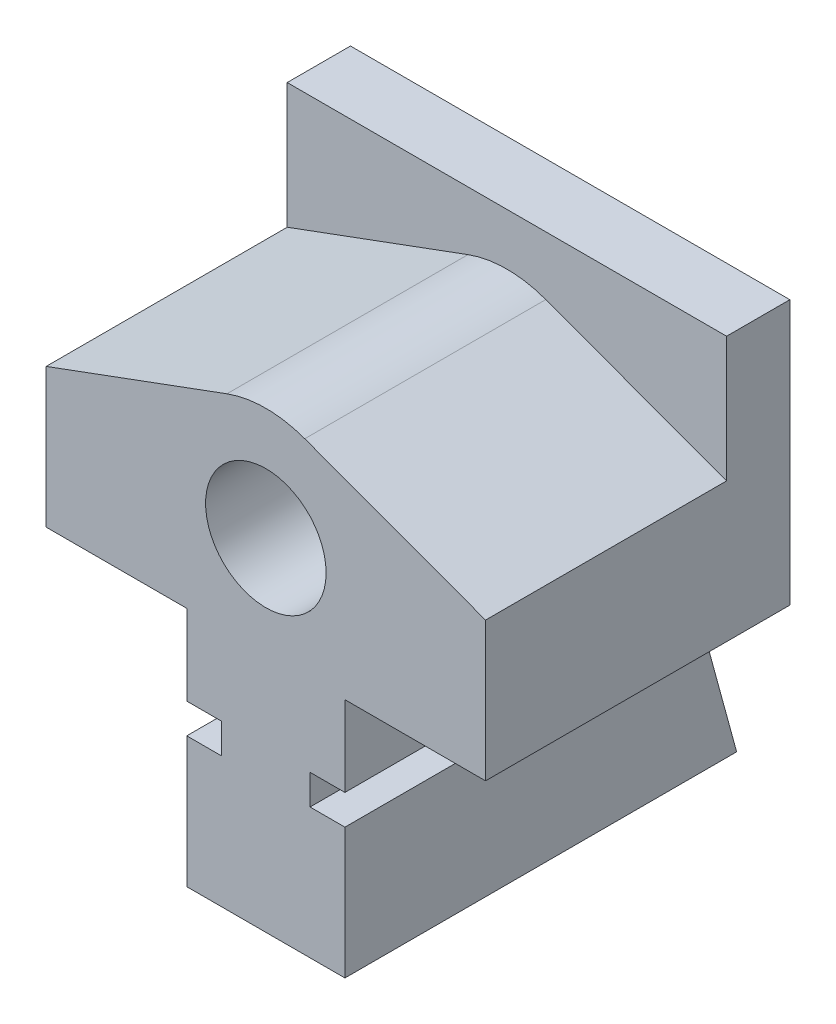
from build123d import *

# Parameters (mm, degrees)
EXTRUDE1_DEPTH                   = 38.1
EXTRUDE2_DEPTH                   = 38.1
SKETCH4_W                        = 69.45
SKETCH4_H                        = 41.814012965
EXTRUDE3_DEPTH                   = 10
EXTRUDE4_DEPTH                   = 23.8125
CUT_EXTRUDE4_DEPTH               = 107.888880382
CUT_EXTRUDE4_DEPTH_BACK          = 107.888880382
F_25_0_1495_DIAMETER_HOLE1_D     = 3.7973
F_25_0_1495_DIAMETER_HOLE1_DEPTH = 26.9875
F_25_0_1495_DIAMETER_HOLE1_TIP   = 1.140824014
SKETCH11_R                       = 9.525
CUT_EXTRUDE2_DEPTH               = 30.1625
SKETCH12_R                       = 10.31875
CUT_EXTRUDE3_DEPTH               = 93.736926805
CUT_EXTRUDE5_START               = -12.5
CUT_EXTRUDE5_DEPTH               = 25


# Read off the part's stored shape, not the designer's step: Cut-Extrude5
with BuildPart() as part:
    # Sketch1 → Extrude1 (new body)
    with BuildSketch(Plane.XY):
        Polygon((12.5, 0), (-12.5, 0), (-12.5, 20.6502), (-6.9882, 20.6502), (-6.9882, 25.4), (-12.5, 25.4), (-12.5, 38.1), (-34.725, 38.1), (-34.725, 49.506590038), (34.725, 49.506590038), (34.725, 38.1), (12.5, 38.1), (12.5, 25.4), (6.9882, 25.4), (6.9882, 20.6502), (12.5, 20.6502), align=None)
    extrude(amount=-EXTRUDE1_DEPTH)

    # Sketch2 → Extrude2 (add)
    with BuildSketch(Plane.XY):
        with BuildLine():
            Line((-34.725, 60.107063342), (-34.725, 49.506590038))
            Line((-34.725, 49.506590038), (34.725, 49.506590038))
            Line((34.725, 49.506590038), (34.725, 60.107063342))
            Line((34.725, 60.107063342), (6.151391783, 70.643423952))
            ThreePointArc((6.151391783, 70.643423952), (0, 71.741434289), (-6.151391783, 70.643423952))
            Line((-6.151391783, 70.643423952), (-34.725, 60.107063342))
        make_face()
    extrude(amount=-EXTRUDE2_DEPTH)

    # Sketch4 → Extrude3 (add)
    with BuildSketch(Plane(origin=(0, 0, -38.1), x_dir=(-1, 0, 0), z_dir=(0, 0, -1))):
        with Locations((0, 59.007006483)):
            Rectangle(SKETCH4_W, SKETCH4_H)
    extrude(amount=EXTRUDE3_DEPTH)

    # Sketch13 → Extrude4 (add)
    with BuildSketch(Plane(origin=(0, 0, -38.1), x_dir=(-1, 0, 0), z_dir=(0, 0, -1))):
        Polygon((12.5, 38.1), (-12.5, 38.1), (-12.5, 25.4), (-6.9882, 25.4), (-6.9882, 20.6502), (-12.5, 20.6502), (-12.5, 0), (12.5, 0), (12.5, 20.6502), (6.9882, 20.6502), (6.9882, 25.4), (12.5, 25.4), align=None)
    extrude(amount=EXTRUDE4_DEPTH)

    # Sketch14 → Cut-Extrude4 (cut, two sides: drawn at the far end of the back side and taken through both)
    with BuildSketch(Plane(origin=(0, 0, 0), x_dir=(0, 0, -1), z_dir=(1, 0, 0)).offset(-CUT_EXTRUDE4_DEPTH_BACK)):
        with BuildLine():
            Line((61.9125, 38.1), (43.1, 38.1))
            ThreePointArc((43.1, 38.1), (44.02993597, 35.85493597), (46.275, 34.925))
            Line((46.275, 34.925), (61.9125, 34.925))
            Line((61.9125, 34.925), (61.9125, 38.1))
        make_face()
    extrude(amount=CUT_EXTRUDE4_DEPTH + CUT_EXTRUDE4_DEPTH_BACK, mode=Mode.SUBTRACT)

    # #25 (0.1495) Diameter Hole1
    with Locations(Plane.XZ):
        with Locations((-7.9375, -30.1625), (7.9375, -30.1625)):
            Hole(F_25_0_1495_DIAMETER_HOLE1_D / 2, depth=F_25_0_1495_DIAMETER_HOLE1_DEPTH)
            with Locations((0, 0, -(F_25_0_1495_DIAMETER_HOLE1_DEPTH + F_25_0_1495_DIAMETER_HOLE1_TIP / 2))):  # 118° drill point
                Cone(0, F_25_0_1495_DIAMETER_HOLE1_D / 2, F_25_0_1495_DIAMETER_HOLE1_TIP, mode=Mode.SUBTRACT)

    # Sketch11 → Cut-Extrude2 (cut)
    with BuildSketch(Plane.XY):
        with Locations((0, 53.961434289)):
            Circle(SKETCH11_R)
    extrude(amount=-CUT_EXTRUDE2_DEPTH, mode=Mode.SUBTRACT)

    # Sketch12 → Cut-Extrude3 (cut, through all)
    with BuildSketch(Plane.XY.offset(-30.1625)):
        with Locations((0, 53.961434289)):
            Circle(SKETCH12_R)
    extrude(amount=-CUT_EXTRUDE3_DEPTH, mode=Mode.SUBTRACT)

    # Cut-Extrude5 outline → Cut-Extrude5 (cut)
    with BuildSketch(Plane(origin=(0, 0, 0), x_dir=(0, 0, -1), z_dir=(1, 0, 0)).offset(CUT_EXTRUDE5_START)):
        Polygon((61.9125, 34.925), (52.3875, 34.925), (61.9125, 0), align=None)
    extrude(amount=CUT_EXTRUDE5_DEPTH, mode=Mode.SUBTRACT)


solid = part.part
